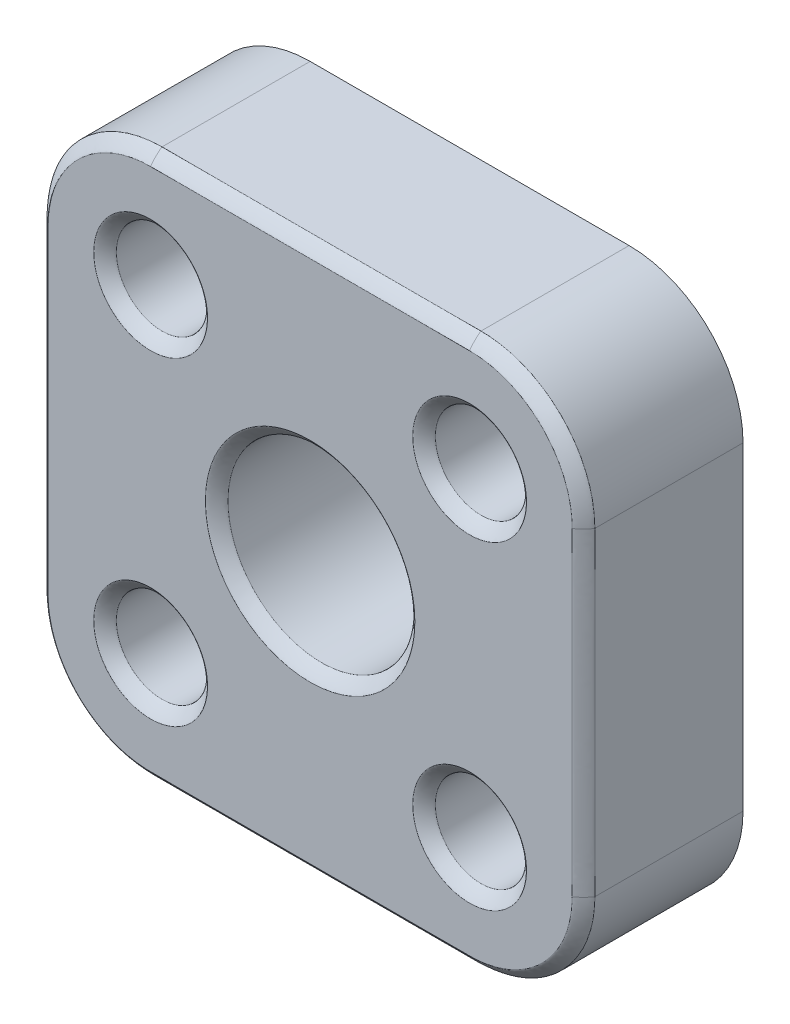
from build123d import *

# Parameters (mm, degrees)
ESQUISSE1_R             = 2
BOSS_EXTRU_1_DEPTH      = 7
ESQUISSE2_R             = 4.1
ENL_V_MAT_EXTRU_1_DEPTH = 7
CONG_1_SIZE             = 0.5


with BuildPart() as part:
    # Esquisse1 → Boss.-Extru.1 (new body)
    with BuildSketch(Plane.XY):
        with BuildLine():
            Line((7, -12), (-7, -12))
            ThreePointArc((-7, -12), (-10.535533906, -10.535533906), (-12, -7))
            Line((-12, -7), (-12, 7))
            ThreePointArc((-12, 7), (-10.535533906, 10.535533906), (-7, 12))
            Line((-7, 12), (7, 12))
            ThreePointArc((7, 12), (10.535533906, 10.535533906), (12, 7))
            Line((12, 7), (12, -7))
            ThreePointArc((12, -7), (10.535533906, -10.535533906), (7, -12))
        make_face()
        with Locations((-7, 7)):
            Circle(ESQUISSE1_R, mode=Mode.SUBTRACT)
        with Locations((7, 7)):
            Circle(ESQUISSE1_R, mode=Mode.SUBTRACT)
        with Locations((7, -7)):
            Circle(ESQUISSE1_R, mode=Mode.SUBTRACT)
        with Locations((-7, -7)):
            Circle(ESQUISSE1_R, mode=Mode.SUBTRACT)
    extrude(amount=BOSS_EXTRU_1_DEPTH)

    # Esquisse2 → Enlèv. mat.-Extru.1 (cut)
    with BuildSketch(Plane(origin=(0, 0, 0), x_dir=(-1, 0, 0), z_dir=(0, 0, -1))):
        Circle(ESQUISSE2_R)
    extrude(amount=-ENL_V_MAT_EXTRU_1_DEPTH, mode=Mode.SUBTRACT)

    # Congé1
    # a fillet whose section is not a circle: 0.5 mm, written as the material it takes off along each edge
    with BuildSketch(Plane(origin=(-7, -7, 7), x_dir=(1, 0, 0), z_dir=(0, -1, 0))) as cong_1_piece_1:
        with BuildLine():
            Bezier((2 + CONG_1_SIZE, 0), (2, 0), (2, -CONG_1_SIZE), weights=[1, 0.111111111, 1])
            Line((2, -CONG_1_SIZE), (2, 0))
            Line((2, 0), (2 + CONG_1_SIZE, 0))
        make_face()
    revolve(axis=Axis((-7, -7, 7), (0, 0, 1)), mode=Mode.SUBTRACT)
    with BuildSketch(Plane(origin=(7, -7, 7), x_dir=(1, 0, 0), z_dir=(0, -1, 0))) as cong_1_piece_2:
        with BuildLine():
            Bezier((2 + CONG_1_SIZE, 0), (2, 0), (2, -CONG_1_SIZE), weights=[1, 0.111111111, 1])
            Line((2, -CONG_1_SIZE), (2, 0))
            Line((2, 0), (2 + CONG_1_SIZE, 0))
        make_face()
    revolve(axis=Axis((7, -7, 7), (0, 0, 1)), mode=Mode.SUBTRACT)
    with BuildSketch(Plane(origin=(7, 7, 7), x_dir=(1, 0, 0), z_dir=(0, -1, 0))) as cong_1_piece_3:
        with BuildLine():
            Bezier((2 + CONG_1_SIZE, 0), (2, 0), (2, -CONG_1_SIZE), weights=[1, 0.111111111, 1])
            Line((2, -CONG_1_SIZE), (2, 0))
            Line((2, 0), (2 + CONG_1_SIZE, 0))
        make_face()
    revolve(axis=Axis((7, 7, 7), (0, 0, 1)), mode=Mode.SUBTRACT)
    with BuildSketch(Plane(origin=(-7, 7, 7), x_dir=(1, 0, 0), z_dir=(0, -1, 0))) as cong_1_piece_4:
        with BuildLine():
            Bezier((2 + CONG_1_SIZE, 0), (2, 0), (2, -CONG_1_SIZE), weights=[1, 0.111111111, 1])
            Line((2, -CONG_1_SIZE), (2, 0))
            Line((2, 0), (2 + CONG_1_SIZE, 0))
        make_face()
    revolve(axis=Axis((-7, 7, 7), (0, 0, 1)), mode=Mode.SUBTRACT)
    with BuildSketch(Plane(origin=(-12, -7, 7), x_dir=(1, 0, 0), z_dir=(0, 1, 0)), Plane(origin=(-7, 12, 7), x_dir=(0, -1, 0), z_dir=(1, 0, 0)), Plane(origin=(12, 7, 7), x_dir=(-1, 0, 0), z_dir=(0, -1, 0))) as cong_1_piece_5:
        with BuildLine():
            Bezier((CONG_1_SIZE, 0), (0, 0), (0, CONG_1_SIZE), weights=[1, 0.111111111, 1])
            Line((0, CONG_1_SIZE), (0, 0))
            Line((0, 0), (CONG_1_SIZE, 0))
        make_face()
    extrude(amount=14, mode=Mode.SUBTRACT)
    with BuildSketch(Plane(origin=(-7, 7, 7), x_dir=(-1, 0, 0), z_dir=(0, -1, 0))) as cong_1_piece_6:
        with BuildLine():
            Bezier((5 - CONG_1_SIZE, 0), (5, 0), (5, CONG_1_SIZE), weights=[1, 0.111111111, 1])
            Line((5, CONG_1_SIZE), (5, 0))
            Line((5, 0), (5 - CONG_1_SIZE, 0))
        make_face()
    revolve(axis=Axis((-7, 7, 7), (0, 0, -1)), revolution_arc=90, mode=Mode.SUBTRACT)
    with BuildSketch(Plane(origin=(7, 7, 7), x_dir=(0, 1, 0), z_dir=(-1, 0, 0))) as cong_1_piece_7:
        with BuildLine():
            Bezier((5 - CONG_1_SIZE, 0), (5, 0), (5, CONG_1_SIZE), weights=[1, 0.111111111, 1])
            Line((5, CONG_1_SIZE), (5, 0))
            Line((5, 0), (5 - CONG_1_SIZE, 0))
        make_face()
    revolve(axis=Axis((7, 7, 7), (0, 0, -1)), revolution_arc=90, mode=Mode.SUBTRACT)
    with BuildSketch(Plane(origin=(7, -7, 7), x_dir=(1, 0, 0), z_dir=(0, 1, 0))) as cong_1_piece_8:
        with BuildLine():
            Bezier((5, CONG_1_SIZE), (5, 0), (5 - CONG_1_SIZE, 0), weights=[1, 0.111111111, 1])
            Line((5 - CONG_1_SIZE, 0), (5, 0))
            Line((5, 0), (5, CONG_1_SIZE))
        make_face()
    revolve(axis=Axis((7, -7, 7), (0, 0, -1)), revolution_arc=90, mode=Mode.SUBTRACT)
    with BuildSketch(Plane(origin=(7, -12, 7), x_dir=(0, 0, -1), z_dir=(-1, 0, 0))) as cong_1_piece_9:
        with BuildLine():
            Bezier((CONG_1_SIZE, 0), (0, 0), (0, -CONG_1_SIZE), weights=[1, 0.111111111, 1])
            Line((0, -CONG_1_SIZE), (0, 0))
            Line((0, 0), (CONG_1_SIZE, 0))
        make_face()
    extrude(amount=14, mode=Mode.SUBTRACT)
    with BuildSketch(Plane(origin=(-7, -7, 7), x_dir=(0, -1, 0), z_dir=(1, 0, 0))) as cong_1_piece_10:
        with BuildLine():
            Bezier((5, CONG_1_SIZE), (5, 0), (5 - CONG_1_SIZE, 0), weights=[1, 0.111111111, 1])
            Line((5 - CONG_1_SIZE, 0), (5, 0))
            Line((5, 0), (5, CONG_1_SIZE))
        make_face()
    revolve(axis=Axis((-7, -7, 7), (0, 0, -1)), revolution_arc=90, mode=Mode.SUBTRACT)
    with BuildSketch(Plane(origin=(0, 0, 7), x_dir=(-1, 0, 0), z_dir=(0, -1, 0))) as cong_1_piece_11:
        with BuildLine():
            Bezier((4.1 + CONG_1_SIZE, 0), (4.1, 0), (4.1, CONG_1_SIZE), weights=[1, 0.111111111, 1])
            Line((4.1, CONG_1_SIZE), (4.1, 0))
            Line((4.1, 0), (4.1 + CONG_1_SIZE, 0))
        make_face()
    revolve(axis=Axis((0, 0, 7), (0, 0, -1)), mode=Mode.SUBTRACT)


solid = part.part
